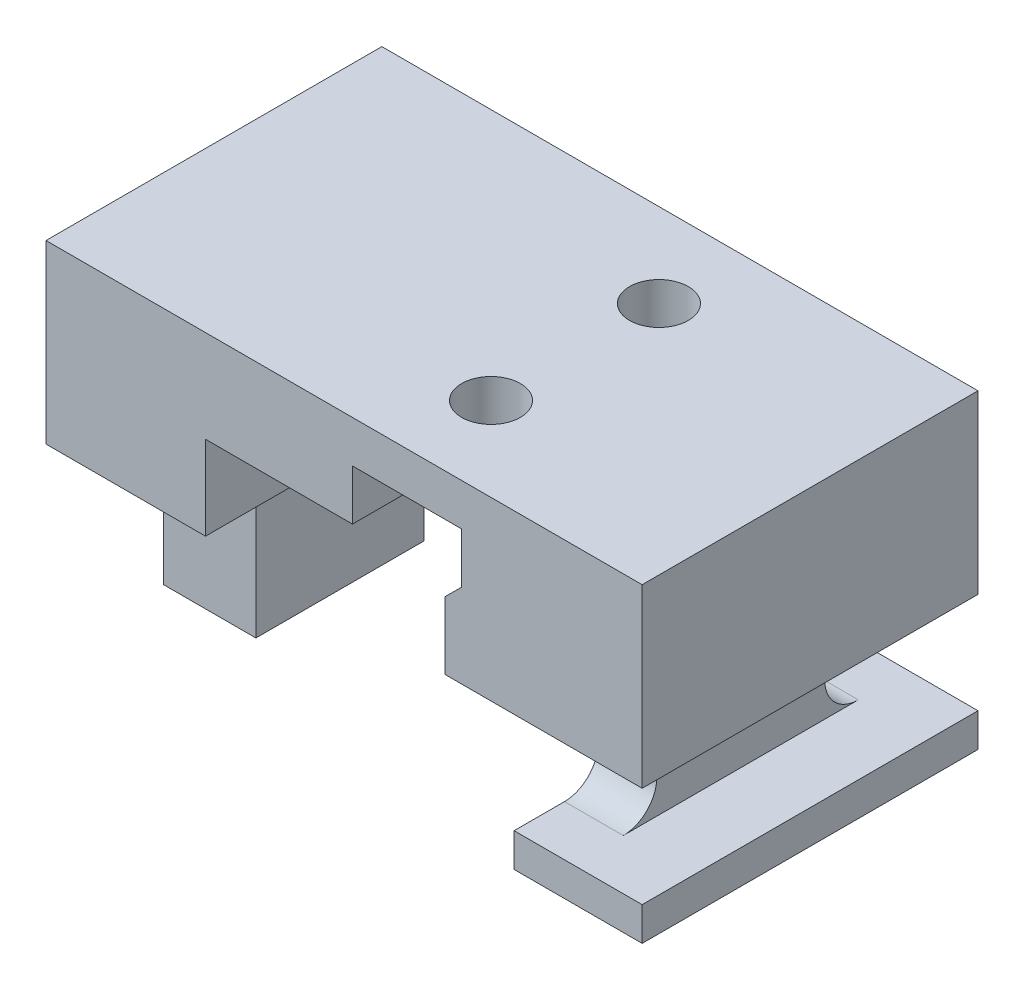
from build123d import *

# Parameters (mm, degrees)
BOSS_EXTRUDE1_DEPTH = 20
SKETCH2_R           = 1.75
CUT_EXTRUDE1_DEPTH  = 3.5
SKETCH4_W           = 5.5
SKETCH4_H           = 10
BOSS_EXTRUDE2_DEPTH = 8.75
SKETCH5_R           = 0.875
CUT_EXTRUDE2_DEPTH  = 10
SKETCH6_W           = 3.5
SKETCH6_H           = 6
BOSS_EXTRUDE3_DEPTH = 5
FILLET1_R           = 1
SKETCH8_W           = 6.5
SKETCH8_H           = 3
CUT_EXTRUDE3_DEPTH  = 30
CHAMFER1_SIZE       = 1
SKETCH10_W          = 2
SKETCH10_H          = 10.5
BOSS_EXTRUDE5_DEPTH = 20
SKETCH11_W          = 2
SKETCH11_H          = 20
BOSS_EXTRUDE6_DEPTH = 5
SKETCH12_W          = 7.625
SKETCH12_H          = 20
BOSS_EXTRUDE7_DEPTH = 2
FILLET2_R           = 2


with BuildPart() as part:
    # Sketch1 → Boss-Extrude1 (new body)
    with BuildSketch(Plane.XY):
        Polygon((-16.75, 0), (16.75, 0), (16.75, -10.5), (5, -10.5), (5, -5.5), (5, -3.5), (0.5, -3.5), (0.5, -5.5), (-11.25, -5.5), (-11.25, -10.5), (-16.75, -10.5), align=None)
    extrude(amount=BOSS_EXTRUDE1_DEPTH)

    # Sketch2 → Cut-Extrude1 (cut)
    with BuildSketch(Plane.XZ.offset(3.5)):
        with Locations((2.75, 15)):
            Circle(SKETCH2_R)
        with Locations((2.75, 5)):
            Circle(SKETCH2_R)
    extrude(amount=-CUT_EXTRUDE1_DEPTH, mode=Mode.SUBTRACT)

    # Sketch4 → Boss-Extrude2 (add)
    with BuildSketch(Plane.XZ.offset(10.5)):
        with Locations((-14, 10)):
            Rectangle(SKETCH4_W, SKETCH4_H)
    extrude(amount=BOSS_EXTRUDE2_DEPTH)

    # Sketch5 → Cut-Extrude2 (cut)
    with BuildSketch(Plane.XZ.offset(19.25)):
        with Locations((-14, 10)):
            Circle(SKETCH5_R)
    extrude(amount=-CUT_EXTRUDE2_DEPTH, mode=Mode.SUBTRACT)

    # Sketch6 → Boss-Extrude3 (add, symmetric)
    with BuildSketch(Plane.XY.offset(10)):
        with Locations((10.875, -13.5)):
            Rectangle(SKETCH6_W, SKETCH6_H)
    extrude(amount=BOSS_EXTRUDE3_DEPTH, both=True)

    # Fillet1
    fillet1_edges = [part.edges().sort_by_distance(p)[0] for p in [
        (-14, -10.5, 5),
        (-14, -10.5, 15),
        (10.875, -10.5, 5),
        (10.875, -10.5, 15),
    ]]
    fillet(fillet1_edges, radius=FILLET1_R)

    # Sketch8 → Cut-Extrude3 (cut)
    with BuildSketch(Plane.XY.offset(20)):
        with Locations((2.75, -4)):
            Rectangle(SKETCH8_W, SKETCH8_H)
    extrude(amount=-CUT_EXTRUDE3_DEPTH, mode=Mode.SUBTRACT)

    # Chamfer1
    chamfer1_edges = [part.edges().sort_by_distance(p)[0] for p in [
        (5, -5.5, 10),
    ]]
    chamfer(chamfer1_edges, length=CHAMFER1_SIZE - 0.0001)  # a hair under: the kernel refuses the full size

    # Sketch10 → Boss-Extrude5 (add)
    with BuildSketch(Plane.XY.offset(20)):
        with Locations((-17.75, -5.25)):
            Rectangle(SKETCH10_W, SKETCH10_H)
    extrude(amount=-BOSS_EXTRUDE5_DEPTH)

    # Sketch11 → Boss-Extrude6 (add)
    with BuildSketch(Plane.XZ.offset(10.5)):
        with Locations((-10.25, 10)):
            Rectangle(SKETCH11_W, SKETCH11_H)
    extrude(amount=-BOSS_EXTRUDE6_DEPTH)

    # Sketch12 → Boss-Extrude7 (add)
    with BuildSketch(Plane.XZ.offset(16.5)):
        with Locations((12.9375, 10)):
            Rectangle(SKETCH12_W, SKETCH12_H)
    extrude(amount=BOSS_EXTRUDE7_DEPTH)

    # Fillet2
    fillet2_edges = [part.edges().sort_by_distance(p)[0] for p in [
        (10.875, -16.5, 5),
        (10.875, -16.5, 15),
    ]]
    fillet(fillet2_edges, radius=FILLET2_R)


solid = part.part
